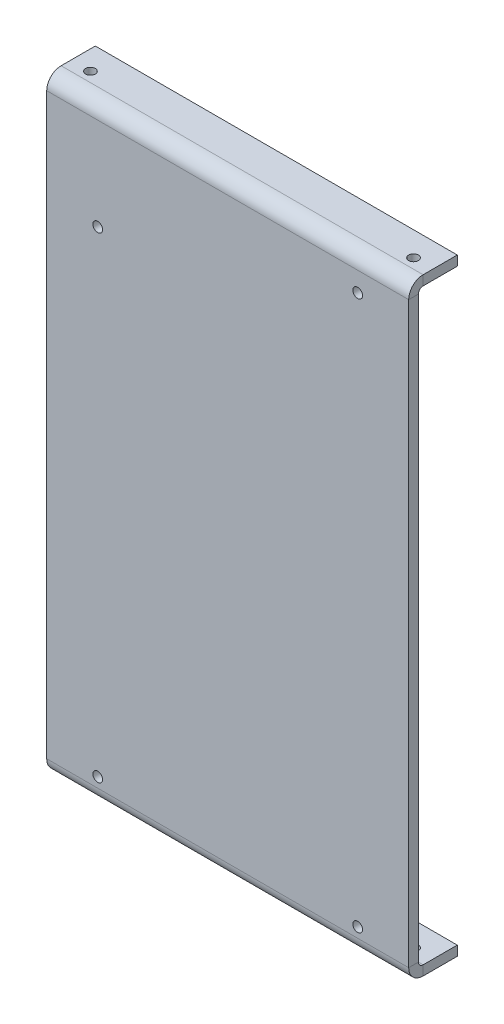
from build123d import *

# Parameters (mm, degrees)
SKETCH1_W                      = 125
SKETCH1_H                      = 74.5
SKETCH1_R                      = 1
BASE_FLANGE1_DEPTH             = 2
EDGE_FLANGE2_STRIP_W           = 9.9304
EDGE_FLANGE2_STRIP_H           = 2
EDGE_FLANGE2_STRIP_CUT_DEPTH   = 74.5
EDGE_FLANGE2_STRIP_2_W         = 9.9304
EDGE_FLANGE2_STRIP_2_H         = 2
EDGE_FLANGE2_STRIP_CUT_2_DEPTH = 74.5
EDGE_FLANGE2_DEPTH             = 74.5
EDGE_FLANGE2_BEND_DEPTH        = 74.5
SKETCH20_R                     = 1
CUT_EXTRUDE2_DEPTH             = 141.78707327


# Sheet-metal steps are written as plain solids
with BuildPart() as part:
    # Sketch1 → Base-Flange1 (new body)
    with BuildSketch(Plane(origin=(0, 0, 0), x_dir=(0, 1, 0), z_dir=(0, 0, 1))):
        with Locations((-55.5, 26.75)):
            Rectangle(SKETCH1_W, SKETCH1_H)
        with Locations(Location((0, 0, 0), (0, 0, 270))):
            Circle(SKETCH1_R, mode=Mode.SUBTRACT)
        with Locations(Location((-113, 0, 0), (0, 0, 270))):
            Circle(SKETCH1_R, mode=Mode.SUBTRACT)
        with Locations(Location((-113, 53.5, 0), (0, 0, 270))):
            Circle(SKETCH1_R, mode=Mode.SUBTRACT)
        with Locations(Location((-15, 53.5, 0), (0, 0, 270))):
            Circle(SKETCH1_R, mode=Mode.SUBTRACT)
    extrude(amount=-BASE_FLANGE1_DEPTH)

    # Edge-Flange2 strip (across the edge) → Edge-Flange2 strip cut (cut)
    with BuildSketch(Plane(origin=(10.5, -118, -2), x_dir=(0, 1, 0), z_dir=(-1, 0, 0))):
        with Locations((-2, -1)):
            Rectangle(EDGE_FLANGE2_STRIP_W, EDGE_FLANGE2_STRIP_H)
    extrude(amount=EDGE_FLANGE2_STRIP_CUT_DEPTH, mode=Mode.SUBTRACT)

    # Edge-Flange2 strip 2 (across the edge) → Edge-Flange2 strip cut 2 (cut)
    with BuildSketch(Plane(origin=(-64, 7, -2), x_dir=(0, -1, 0), z_dir=(1, 0, 0))):
        with Locations((-2, -1)):
            Rectangle(EDGE_FLANGE2_STRIP_2_W, EDGE_FLANGE2_STRIP_2_H)
    extrude(amount=EDGE_FLANGE2_STRIP_CUT_2_DEPTH, mode=Mode.SUBTRACT)

    # Edge-Flange2 section (across the edge) → Edge-Flange2 (add)
    with BuildSketch(Plane(origin=(10.5, -118, -2), x_dir=(0, 1, 0), z_dir=(-1, 0, 0))):
        with BuildLine():
            Line((0, 0.9652), (0, 8))
            Line((0, 8), (2, 8))
            Line((2, 8), (2, 0.9652))
            ThreePointArc((2, 0.9652), (2.282700535, 0.282700535), (2.9652, 0))
            Line((2.9652, 0), (2.9652, -2))
            ThreePointArc((2.9652, -2), (0.868486972, -1.131513028), (0, 0.9652))
        make_face()
    extrude(amount=EDGE_FLANGE2_DEPTH)

    # Edge-Flange2 section 2 (across the edge) → Edge-Flange2 bend (add)
    with BuildSketch(Plane(origin=(-64, 7, -2), x_dir=(0, -1, 0), z_dir=(1, 0, 0))):
        with BuildLine():
            Line((0, 0.9652), (0, 8))
            Line((0, 8), (2, 8))
            Line((2, 8), (2, 0.9652))
            ThreePointArc((2, 0.9652), (2.282700535, 0.282700535), (2.9652, 0))
            Line((2.9652, 0), (2.9652, -2))
            ThreePointArc((2.9652, -2), (0.868486972, -1.131513028), (0, 0.9652))
        make_face()
    extrude(amount=EDGE_FLANGE2_BEND_DEPTH)

    # Sketch20 → Cut-Extrude2 (cut, through all)
    with BuildSketch(Plane.XZ.offset(118)):
        with Locations(Location((-60, -5, 0), (0, 0, 270))):
            Circle(SKETCH20_R)
        with Locations(Location((6.5, -5, 0), (0, 0, 270))):
            Circle(SKETCH20_R)
    extrude(amount=-CUT_EXTRUDE2_DEPTH, mode=Mode.SUBTRACT)


solid = part.part
